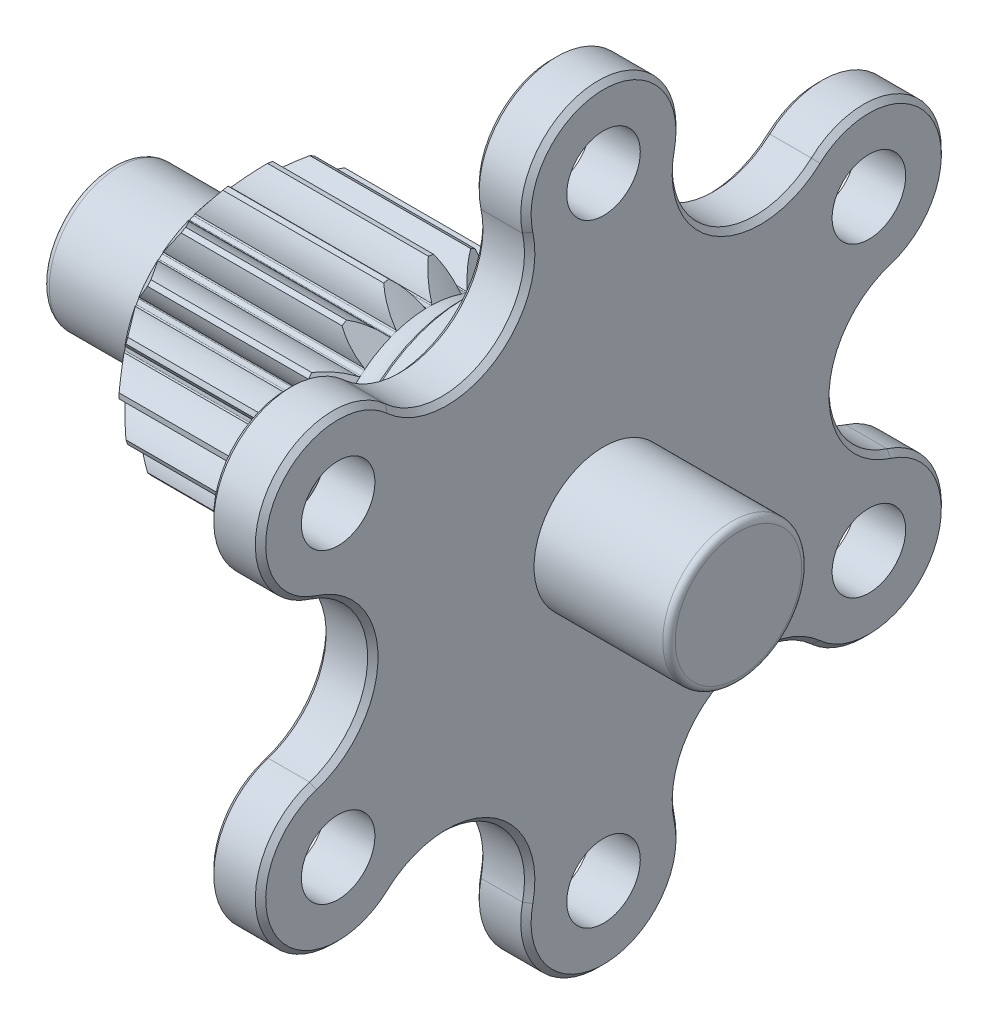
from build123d import *
from OCP.BRepFilletAPI import BRepFilletAPI_MakeChamfer

# Parameters (mm, degrees)
SKETCH1_R              = 47
BASE_EXTRUDE_DEPTH     = 6.35
M8_CLEARANCE_HOLES_D   = 9
CIRPATTERN_COUNT       = 6
CUT_EXTRUDE_DEPTH      = 67.770670957
CUT_EXTRUDE_DEPTH_BACK = 67.770670957
CHAMFER1_SIZE          = 0.635
SKETCH8_R              = 15.748
SHAFT_EXTRUDE_DEPTH    = 52.5820005
CHAMFER3_SIZE          = 0.635
SHAFT_CHAMFER_SIZE     = 1
CUT_EXTRUDE1_START     = -12.856999432
SKETCH45_R             = 15.748
SKETCH45_R_2           = 8.5127
CUT_EXTRUDE1_DEPTH     = 12.856999432
SKETCH55_R             = 8.5
BOSS_EXTRUDE4_DEPTH    = 16.51
SKETCH56_R             = 8.5127
BOSS_EXTRUDE5_DEPTH    = 1.143
FILLET9_R              = 1.524
CUT_EXTRUDE17_START    = -25.4
CUT_EXTRUDE17_DEPTH    = 25.4
CHAMFER6_SIZE          = 2.54
CHAMFER6_SIZE2         = 3.027054125
FILLET10_R             = 1.27
FILLET11_R             = 0.762
FILLET12_R             = 0.762
SKETCH95_R             = 6.614412416
SKETCH95_R_2           = 4.5
CUT_EXTRUDE18_DEPTH    = 0.254
CHAMFER7_SIZE          = 0.508


with BuildPart() as part:
    # Sketch1 → Base-Extrude (new body)
    with BuildSketch(Plane(origin=(0, 0, 0), x_dir=(0, 0, -1), z_dir=(1, 0, 0))):
        Circle(SKETCH1_R)
    extrude(amount=-BASE_EXTRUDE_DEPTH)

    # M8 Clearance Holes (through all)
    with Locations(Plane(origin=(0, 0, 0), x_dir=(0, 0, -1), z_dir=(1, 0, 0))):
        with Locations((0, -37.5)):
            m8_clearance_holes = Hole(M8_CLEARANCE_HOLES_D / 2)

    # CirPattern: M8 Clearance Holes ×6 about axis
    cirpattern_axis = Axis((0, 0, 0), (1, 0, 0))
    for i in range(1, CIRPATTERN_COUNT):
        add(m8_clearance_holes.rotate(cirpattern_axis, i * 360 / CIRPATTERN_COUNT), mode=Mode.SUBTRACT)

    # Sketch19 → Cut-Extrude (cut, two sides: drawn at the far end of the back side and taken through both)
    with BuildSketch(Plane(origin=(0, 0, 0), x_dir=(0, 0, -1), z_dir=(1, 0, 0)).offset(-CUT_EXTRUDE_DEPTH_BACK)):
        with BuildLine():
            ThreePointArc((9.274838239, 35.443941724), (14.114033661, 24.446223401), (26.057934823, 25.754216393))
            ThreePointArc((26.057934823, 25.754216393), (33.921184851, 28.139425108), (40.703194264, 23.499999504))
            ThreePointArc((40.703194264, 23.499999504), (23.500000227, 40.703193847), (-4.7e-08, 47))
            ThreePointArc((-4.7e-08, 47), (7.40886473, 43.446320157), (9.274838239, 35.443941724))
        make_face()
        with BuildLine():
            ThreePointArc((-26.057934823, 25.754216393), (-14.114033661, 24.446223401), (-9.274838239, 35.443941724))
            ThreePointArc((-9.274838239, 35.443941724), (-7.40886476, 43.44632012), (-4.7e-08, 47))
            ThreePointArc((-4.7e-08, 47), (-23.500000787, 40.703193523), (-40.703194863, 23.499998466))
            ThreePointArc((-40.703194863, 23.499998466), (-33.921185443, 28.139425017), (-26.057934823, 25.754216393))
        make_face()
        with BuildLine():
            ThreePointArc((40.703193464, -23.50000089), (47, -8e-07), (40.703194264, 23.499999504))
            ThreePointArc((40.703194264, 23.499999504), (41.33004921, 15.30689472), (35.332773062, 9.689725331))
            ThreePointArc((35.332773062, 9.689725331), (28.228067323, 0), (35.332773062, -9.689725331))
            ThreePointArc((35.332773062, -9.689725331), (41.330049499, -15.306895465), (40.703193464, -23.50000089))
        make_face()
        with BuildLine():
            ThreePointArc((-35.332773062, 9.689725331), (-41.330048992, 15.306894161), (-40.703194863, 23.499998466))
            ThreePointArc((-40.703194863, 23.499998466), (-47, -6.9e-08), (-40.703194794, -23.499998586))
            ThreePointArc((-40.703194794, -23.499998586), (-41.330049018, -15.306894226), (-35.332773062, -9.689725331))
            ThreePointArc((-35.332773062, -9.689725331), (-28.228067323, 0), (-35.332773062, 9.689725331))
        make_face()
        with BuildLine():
            ThreePointArc((-26.057934823, -25.754216393), (-33.921185375, -28.139425028), (-40.703194794, -23.499998586))
            ThreePointArc((-40.703194794, -23.499998586), (-23.500000688, -40.703193581), (4.4e-08, -47))
            ThreePointArc((4.4e-08, -47), (-7.408864732, -43.446320155), (-9.274838239, -35.443941724))
            ThreePointArc((-9.274838239, -35.443941724), (-14.114033661, -24.446223401), (-26.057934823, -25.754216393))
        make_face()
        with BuildLine():
            ThreePointArc((4.4e-08, -47), (23.499999574, -40.703194224), (40.703193464, -23.50000089))
            ThreePointArc((40.703193464, -23.50000089), (33.92118406, -28.13942523), (26.057934823, -25.754216393))
            ThreePointArc((26.057934823, -25.754216393), (14.114033661, -24.446223401), (9.274838239, -35.443941724))
            ThreePointArc((9.274838239, -35.443941724), (7.408864759, -43.446320121), (4.4e-08, -47))
        make_face()
    extrude(amount=CUT_EXTRUDE_DEPTH + CUT_EXTRUDE_DEPTH_BACK, mode=Mode.SUBTRACT)

    # Chamfer1
    chamfer1_edges = [part.edges().sort_by_distance(p)[0] for p in [
        (-6.35, -24.446223401, 14.114033661),
        (-6.35, 24.446223401, -14.114033661),
        (-6.35, 24.446223401, 14.114033661),
        (-6.35, 23.5, 40.703193978),
        (-6.35, 47, 0),
        (-6.35, -24.446223401, -14.114033661),
        (-6.35, -23.5, -40.703193978),
        (-6.35, -47, 0),
        (-6.35, 0, 28.228067323),
        (-6.35, -23.5, 40.703193978),
        (-6.35, 0, -28.228067323),
        (-6.35, 23.5, -40.703193978),
    ]]
    chamfer(chamfer1_edges, length=CHAMFER1_SIZE)

    # Sketch8 → Shaft-Extrude (add)
    with BuildSketch(Plane.ZY.offset(6.35)):
        with Locations(Location((0, 0, 0), (0, 0, 180))):
            Circle(SKETCH8_R)
    extrude(amount=SHAFT_EXTRUDE_DEPTH)

    # Chamfer3
    chamfer3_edges = [part.edges().sort_by_distance(p)[0] for p in [
        (0, 24.446223401, -14.114033661),
        (0, -24.446223401, 14.114033661),
        (0, -24.446223401, -14.114033661),
        (0, -47, 0),
        (0, -23.5, -40.703193978),
        (0, 24.446223401, 14.114033661),
        (0, 47, 0),
        (0, 23.5, 40.703193978),
        (0, 0, -28.228067323),
        (0, 23.5, -40.703193978),
        (0, 0, 28.228067323),
        (0, -23.5, 40.703193978),
    ]]
    chamfer(chamfer3_edges, length=CHAMFER3_SIZE)

    # Shaft Chamfer
    shaft_chamfer_edges = [part.edges().sort_by_distance(p)[0] for p in [
        (-58.9320005, 0, 15.748),
    ]]
    chamfer(shaft_chamfer_edges, length=SHAFT_CHAMFER_SIZE)

    # Sketch45 → Cut-Extrude1 (cut)
    with BuildSketch(Plane.ZY.offset(58.9320005).offset(CUT_EXTRUDE1_START)):
        with Locations(Location((0, 0, 0), (0, 0, 180))):
            Circle(SKETCH45_R)
        Circle(SKETCH45_R_2, mode=Mode.SUBTRACT)
    extrude(amount=CUT_EXTRUDE1_DEPTH, mode=Mode.SUBTRACT)

    # Sketch55 → Boss-Extrude4 (add)
    with BuildSketch(Plane(origin=(0, 0, 0), x_dir=(0, 0, -1), z_dir=(1, 0, 0))):
        Circle(SKETCH55_R)
    extrude(amount=BOSS_EXTRUDE4_DEPTH)

    # Sketch56 → Boss-Extrude5 (add)
    with BuildSketch(Plane.ZY.offset(58.9320005)):
        Circle(SKETCH56_R)
    extrude(amount=BOSS_EXTRUDE5_DEPTH)

    # Fillet9
    fillet9_edges = [part.edges().sort_by_distance(p)[0] for p in [
        (-46.075001068, 0, -8.5127),
    ]]
    fillet(fillet9_edges, radius=FILLET9_R)

    # Cut-Extrude17: read off the stored shape, not the designer's step
    # Cut-Extrude17 outline → Cut-Extrude17 (cut)
    with BuildSketch(Plane.ZY.offset(46.075001068).offset(CUT_EXTRUDE17_START)):
        with BuildLine():
            ThreePointArc((-14.684667578, 5.688588763), (-12.987779277, 6.048943991), (-11.254165829, 5.986733001))
            ThreePointArc((-11.254165829, 5.986733001), (-11.162537651, 6.019355375), (-11.090657474, 6.084877757))
            ThreePointArc((-11.090657474, 6.084877757), (-10.95542401, 6.325117018), (-10.814987438, 6.562352263))
            ThreePointArc((-10.814987438, 6.562352263), (-10.794183479, 6.657363514), (-10.811745764, 6.753027031))
            ThreePointArc((-10.811745764, 6.753027031), (-11.732428783, 8.223274824), (-12.268796147, 9.873000815))
            ThreePointArc((-12.268796147, 9.873000815), (-13.63816805, 7.874000015), (-14.684667578, 5.688588763))
        make_face()
        with BuildLine():
            ThreePointArc((-12.469388985, 2.647934833), (-13.837402385, 3.714623697), (-14.905662359, 5.081410594))
            ThreePointArc((-14.905662359, 5.081410594), (-15.508752491, 2.73461152), (-15.744685706, 0.323072774))
            ThreePointArc((-15.744685706, 0.323072774), (-14.273381038, 1.242065902), (-12.623039862, 1.776537414))
            ThreePointArc((-12.623039862, 1.776537414), (-12.548095048, 1.8385311), (-12.50295975, 1.924686467))
            ThreePointArc((-12.50295975, 1.924686467), (-12.458048528, 2.196690097), (-12.407220551, 2.467650443))
            ThreePointArc((-12.407220551, 2.467650443), (-12.420166986, 2.564047187), (-12.469388985, 2.647934833))
        make_face()
        with BuildLine():
            ThreePointArc((-8.152132052, 13.473761428), (-10.122619264, 12.063667902), (-11.853461818, 10.367976993))
            ThreePointArc((-11.853461818, 10.367976993), (-10.135659657, 10.126230162), (-8.527873304, 9.474840233))
            ThreePointArc((-8.527873304, 9.474840233), (-8.430613472, 9.474156555), (-8.340658225, 9.511142985))
            ThreePointArc((-8.340658225, 9.511142985), (-8.13141367, 9.690641477), (-7.918307228, 9.865537551))
            ThreePointArc((-7.918307228, 9.865537551), (-7.86626214, 9.947703548), (-7.850046439, 10.043604504))
            ThreePointArc((-7.850046439, 10.043604504), (-8.212351117, 11.740077645), (-8.152132052, 13.473761428))
        make_face()
        with BuildLine():
            ThreePointArc((-12.623039866, -1.776537385), (-14.273381041, -1.24206587), (-15.744685707, -0.323072738))
            ThreePointArc((-15.744685707, -0.323072738), (-15.508752498, -2.734611484), (-14.905662371, -5.08141056))
            ThreePointArc((-14.905662371, -5.08141056), (-13.837402393, -3.714623666), (-12.469388991, -2.647934805))
            ThreePointArc((-12.469388991, -2.647934805), (-12.420166992, -2.564047159), (-12.407220557, -2.467650415))
            ThreePointArc((-12.407220557, -2.467650415), (-12.458048533, -2.196690069), (-12.502959755, -1.924686439))
            ThreePointArc((-12.502959755, -1.924686439), (-12.548095052, -1.838531072), (-12.623039866, -1.776537385))
        make_face()
        with BuildLine():
            ThreePointArc((-3.052200518, 15.449387561), (-5.3861332, 14.798279398), (-7.592553624, 13.796834183))
            ThreePointArc((-7.592553624, 13.796834183), (-6.061029895, 12.982143528), (-4.7729934, 11.8201419))
            ThreePointArc((-4.7729934, 11.8201419), (-4.681832885, 11.786234631), (-4.5846525, 11.790224))
            ThreePointArc((-4.5846525, 11.790224), (-4.326634836, 11.887331556), (-4.066562304, 11.978793409))
            ThreePointArc((-4.066562304, 11.978793409), (-3.989553493, 12.038203723), (-3.941515659, 12.122775047))
            ThreePointArc((-3.941515659, 12.122775047), (-3.701742705, 13.840853836), (-3.052200518, 15.449387561))
        make_face()
        with BuildLine():
            ThreePointArc((-11.254165843, -5.986732975), (-12.987779291, -6.048943962), (-14.684667591, -5.68858873))
            ThreePointArc((-14.684667591, -5.68858873), (-13.638168068, -7.873999984), (-12.26879617, -9.873000787))
            ThreePointArc((-12.26879617, -9.873000787), (-11.732428801, -8.223274797), (-10.811745779, -6.753027006))
            ThreePointArc((-10.811745779, -6.753027006), (-10.794183495, -6.657363489), (-10.814987453, -6.562352239))
            ThreePointArc((-10.814987453, -6.562352239), (-10.955424024, -6.325116993), (-11.090657488, -6.084877731))
            ThreePointArc((-11.090657488, -6.084877731), (-11.162537665, -6.01935535), (-11.254165843, -5.986732975))
        make_face()
        with BuildLine():
            ThreePointArc((2.415871444, 15.561589545), (1.8e-08, 15.748), (-2.415871408, 15.561589551))
            ThreePointArc((-2.415871408, 15.561589551), (-1.255350476, 14.272218789), (-0.44242005, 12.739760007))
            ThreePointArc((-0.44242005, 12.739760007), (-0.368354156, 12.676718864), (-0.275670021, 12.647229995))
            ThreePointArc((-0.275670021, 12.647229995), (1.5e-08, 12.65023401), (0.27567005, 12.647229995))
            ThreePointArc((0.27567005, 12.647229995), (0.368354185, 12.676718863), (0.442420079, 12.739760006))
            ThreePointArc((0.442420079, 12.739760006), (1.255350509, 14.272218786), (2.415871444, 15.561589545))
        make_face()
        with BuildLine():
            ThreePointArc((-8.527873325, -9.474840214), (-10.135659679, -10.126230139), (-11.853461841, -10.367976966))
            ThreePointArc((-11.853461841, -10.367976966), (-10.122619291, -12.063667879), (-8.152132082, -13.473761409))
            ThreePointArc((-8.152132082, -13.473761409), (-8.212351144, -11.740077626), (-7.850046462, -10.043604486))
            ThreePointArc((-7.850046462, -10.043604486), (-7.866262163, -9.94770353), (-7.91830725, -9.865537533))
            ThreePointArc((-7.91830725, -9.865537533), (-8.131413692, -9.690641459), (-8.340658247, -9.511142966))
            ThreePointArc((-8.340658247, -9.511142966), (-8.430613493, -9.474156536), (-8.527873325, -9.474840214))
        make_face()
        with BuildLine():
            ThreePointArc((7.592553655, 13.796834166), (5.386133234, 14.798279386), (3.052200553, 15.449387554))
            ThreePointArc((3.052200553, 15.449387554), (3.701742737, 13.840853828), (3.941515687, 12.122775038))
            ThreePointArc((3.941515687, 12.122775038), (3.98955352, 12.038203713), (4.066562331, 11.9787934))
            ThreePointArc((4.066562331, 11.9787934), (4.326634863, 11.887331546), (4.584652527, 11.79022399))
            ThreePointArc((4.584652527, 11.79022399), (4.681832912, 11.78623462), (4.772993427, 11.820141889))
            ThreePointArc((4.772993427, 11.820141889), (6.061029924, 12.982143514), (7.592553655, 13.796834166))
        make_face()
        with BuildLine():
            ThreePointArc((-4.772993427, -11.820141889), (-6.061029924, -12.982143514), (-7.592553655, -13.796834166))
            ThreePointArc((-7.592553655, -13.796834166), (-5.386133234, -14.798279386), (-3.052200553, -15.449387554))
            ThreePointArc((-3.052200553, -15.449387554), (-3.701742737, -13.840853828), (-3.941515687, -12.122775038))
            ThreePointArc((-3.941515687, -12.122775038), (-3.98955352, -12.038203713), (-4.066562331, -11.9787934))
            ThreePointArc((-4.066562331, -11.9787934), (-4.326634863, -11.887331546), (-4.584652527, -11.79022399))
            ThreePointArc((-4.584652527, -11.79022399), (-4.681832912, -11.78623462), (-4.772993427, -11.820141889))
        make_face()
        with BuildLine():
            ThreePointArc((11.853461841, 10.367976966), (10.122619291, 12.063667879), (8.152132082, 13.473761409))
            ThreePointArc((8.152132082, 13.473761409), (8.212351144, 11.740077626), (7.850046462, 10.043604486))
            ThreePointArc((7.850046462, 10.043604486), (7.866262163, 9.94770353), (7.91830725, 9.865537533))
            ThreePointArc((7.91830725, 9.865537533), (8.131413692, 9.690641459), (8.340658247, 9.511142966))
            ThreePointArc((8.340658247, 9.511142966), (8.430613493, 9.474156536), (8.527873325, 9.474840214))
            ThreePointArc((8.527873325, 9.474840214), (10.135659679, 10.126230139), (11.853461841, 10.367976966))
        make_face()
        with BuildLine():
            ThreePointArc((-0.442420079, -12.739760006), (-1.255350509, -14.272218786), (-2.415871444, -15.561589545))
            ThreePointArc((-2.415871444, -15.561589545), (-1.8e-08, -15.748), (2.415871408, -15.561589551))
            ThreePointArc((2.415871408, -15.561589551), (1.255350476, -14.272218789), (0.44242005, -12.739760007))
            ThreePointArc((0.44242005, -12.739760007), (0.368354156, -12.676718864), (0.275670021, -12.647229995))
            ThreePointArc((0.275670021, -12.647229995), (-1.5e-08, -12.65023401), (-0.27567005, -12.647229995))
            ThreePointArc((-0.27567005, -12.647229995), (-0.368354185, -12.676718863), (-0.442420079, -12.739760006))
        make_face()
        with BuildLine():
            ThreePointArc((14.684667591, 5.68858873), (13.638168068, 7.873999984), (12.26879617, 9.873000787))
            ThreePointArc((12.26879617, 9.873000787), (11.732428801, 8.223274797), (10.811745779, 6.753027006))
            ThreePointArc((10.811745779, 6.753027006), (10.794183495, 6.657363489), (10.814987453, 6.562352239))
            ThreePointArc((10.814987453, 6.562352239), (10.955424024, 6.325116993), (11.090657488, 6.084877731))
            ThreePointArc((11.090657488, 6.084877731), (11.162537665, 6.01935535), (11.254165843, 5.986732975))
            ThreePointArc((11.254165843, 5.986732975), (12.987779291, 6.048943962), (14.684667591, 5.68858873))
        make_face()
        with BuildLine():
            ThreePointArc((3.941515659, -12.122775047), (3.701742705, -13.840853836), (3.052200518, -15.449387561))
            ThreePointArc((3.052200518, -15.449387561), (5.3861332, -14.798279398), (7.592553624, -13.796834183))
            ThreePointArc((7.592553624, -13.796834183), (6.061029895, -12.982143528), (4.7729934, -11.8201419))
            ThreePointArc((4.7729934, -11.8201419), (4.681832885, -11.786234631), (4.5846525, -11.790224))
            ThreePointArc((4.5846525, -11.790224), (4.326634836, -11.887331556), (4.066562304, -11.978793409))
            ThreePointArc((4.066562304, -11.978793409), (3.989553493, -12.038203723), (3.941515659, -12.122775047))
        make_face()
        with BuildLine():
            ThreePointArc((15.744685707, 0.323072738), (15.508752498, 2.734611484), (14.905662371, 5.08141056))
            ThreePointArc((14.905662371, 5.08141056), (13.837402393, 3.714623666), (12.469388991, 2.647934805))
            ThreePointArc((12.469388991, 2.647934805), (12.420166992, 2.564047159), (12.407220557, 2.467650415))
            ThreePointArc((12.407220557, 2.467650415), (12.458048533, 2.196690069), (12.502959755, 1.924686439))
            ThreePointArc((12.502959755, 1.924686439), (12.548095052, 1.838531072), (12.623039866, 1.776537385))
            ThreePointArc((12.623039866, 1.776537385), (14.273381041, 1.24206587), (15.744685707, 0.323072738))
        make_face()
        with BuildLine():
            ThreePointArc((7.850046439, -10.043604504), (8.212351117, -11.740077645), (8.152132052, -13.473761428))
            ThreePointArc((8.152132052, -13.473761428), (10.122619264, -12.063667902), (11.853461818, -10.367976993))
            ThreePointArc((11.853461818, -10.367976993), (10.135659657, -10.126230162), (8.527873304, -9.474840233))
            ThreePointArc((8.527873304, -9.474840233), (8.430613472, -9.474156555), (8.340658225, -9.511142985))
            ThreePointArc((8.340658225, -9.511142985), (8.13141367, -9.690641477), (7.918307228, -9.865537551))
            ThreePointArc((7.918307228, -9.865537551), (7.86626214, -9.947703548), (7.850046439, -10.043604504))
        make_face()
        with BuildLine():
            ThreePointArc((14.905662359, -5.081410594), (15.508752491, -2.73461152), (15.744685706, -0.323072774))
            ThreePointArc((15.744685706, -0.323072774), (14.273381038, -1.242065902), (12.623039862, -1.776537414))
            ThreePointArc((12.623039862, -1.776537414), (12.548095048, -1.8385311), (12.50295975, -1.924686467))
            ThreePointArc((12.50295975, -1.924686467), (12.458048528, -2.196690097), (12.407220551, -2.467650443))
            ThreePointArc((12.407220551, -2.467650443), (12.420166986, -2.564047187), (12.469388985, -2.647934833))
            ThreePointArc((12.469388985, -2.647934833), (13.837402385, -3.714623697), (14.905662359, -5.081410594))
        make_face()
        with BuildLine():
            ThreePointArc((10.811745764, -6.753027031), (11.732428783, -8.223274824), (12.268796147, -9.873000815))
            ThreePointArc((12.268796147, -9.873000815), (13.63816805, -7.874000015), (14.684667578, -5.688588763))
            ThreePointArc((14.684667578, -5.688588763), (12.987779277, -6.048943991), (11.254165829, -5.986733001))
            ThreePointArc((11.254165829, -5.986733001), (11.162537651, -6.019355375), (11.090657474, -6.084877757))
            ThreePointArc((11.090657474, -6.084877757), (10.95542401, -6.325117018), (10.814987438, -6.562352263))
            ThreePointArc((10.814987438, -6.562352263), (10.794183479, -6.657363514), (10.811745764, -6.753027031))
        make_face()
    extrude(amount=CUT_EXTRUDE17_DEPTH, mode=Mode.SUBTRACT)

    # Sketch94 → Cut-Revolve2 (revolve, cut)
    with BuildSketch(Plane.XY, mode=Mode.PRIVATE) as cut_revolve2_sk:
        with BuildLine():
            Line((-21.383096822, 12.652967625), (-23.850001068, 15.748))
            Line((-23.850001068, 15.748), (-17.500001068, 15.748))
            ThreePointArc((-17.500001068, 15.748), (-18.429937038, 13.50293597), (-20.675001068, 12.573))
            ThreePointArc((-20.675001068, 12.573), (-21.031299545, 12.593055247), (-21.383096822, 12.652967625))
        make_face()
    revolve(cut_revolve2_sk.sketch.rotate(Axis((-47.599001068, 0, 0), (-1, 0, 0)), 90), axis=Axis((-47.599001068, 0, 0), (-1, 0, 0)), mode=Mode.SUBTRACT)

    # Chamfer6: one chamfer whose edges measure the first distance from different faces: ONE call of the kernel's chamfer builder (chamfer() names one face for all edges)
    chamfer6_edges_1 = [part.edges().sort_by_distance(p)[0] for p in [
        (-46.075001068, 15.508752498, -2.734611484),
    ]]
    chamfer6_side_1 = [part.faces().sort_by_distance(p)[0] for p in [
        (-34.962501068, 15.508752498, -2.734611484),
    ]]
    chamfer6_edges_2 = [part.edges().sort_by_distance(p)[0] for p in [
        (-46.075001068, 13.638168068, -7.873999985),
    ]]
    chamfer6_side_2 = [part.faces().sort_by_distance(p)[0] for p in [
        (-34.962501068, 13.638168068, -7.873999985),
    ]]
    chamfer6_edges_3 = [part.edges().sort_by_distance(p)[0] for p in [
        (-46.075001068, 10.122619291, -12.063667879),
    ]]
    chamfer6_side_3 = [part.faces().sort_by_distance(p)[0] for p in [
        (-34.962501068, 10.122619291, -12.063667879),
    ]]
    chamfer6_edges_4 = [part.edges().sort_by_distance(p)[0] for p in [
        (-46.075001068, 5.386133234, -14.798279386),
    ]]
    chamfer6_side_4 = [part.faces().sort_by_distance(p)[0] for p in [
        (-34.962501068, 5.386133234, -14.798279386),
    ]]
    chamfer6_edges_5 = [part.edges().sort_by_distance(p)[0] for p in [
        (-46.075001068, 1.8e-08, -15.748),
    ]]
    chamfer6_side_5 = [part.faces().sort_by_distance(p)[0] for p in [
        (-34.962501068, 1.8e-08, -15.748),
    ]]
    chamfer6_edges_6 = [part.edges().sort_by_distance(p)[0] for p in [
        (-46.075001068, -5.3861332, -14.798279398),
    ]]
    chamfer6_side_6 = [part.faces().sort_by_distance(p)[0] for p in [
        (-34.962501068, -5.3861332, -14.798279398),
    ]]
    chamfer6_edges_7 = [part.edges().sort_by_distance(p)[0] for p in [
        (-46.075001068, -10.122619263, -12.063667902),
    ]]
    chamfer6_side_7 = [part.faces().sort_by_distance(p)[0] for p in [
        (-34.962501068, -10.122619263, -12.063667902),
    ]]
    chamfer6_edges_8 = [part.edges().sort_by_distance(p)[0] for p in [
        (-46.075001068, -13.63816805, -7.874000015),
    ]]
    chamfer6_side_8 = [part.faces().sort_by_distance(p)[0] for p in [
        (-34.962501068, -13.63816805, -7.874000015),
    ]]
    chamfer6_edges_9 = [part.edges().sort_by_distance(p)[0] for p in [
        (-46.075001068, -15.508752491, -2.73461152),
    ]]
    chamfer6_side_9 = [part.faces().sort_by_distance(p)[0] for p in [
        (-34.962501068, -15.508752491, -2.73461152),
    ]]
    chamfer6_edges_10 = [part.edges().sort_by_distance(p)[0] for p in [
        (-46.075001068, -15.508752498, 2.734611484),
    ]]
    chamfer6_side_10 = [part.faces().sort_by_distance(p)[0] for p in [
        (-34.962501068, -15.508752498, 2.734611484),
    ]]
    chamfer6_edges_11 = [part.edges().sort_by_distance(p)[0] for p in [
        (-46.075001068, -13.638168068, 7.873999985),
    ]]
    chamfer6_side_11 = [part.faces().sort_by_distance(p)[0] for p in [
        (-34.962501068, -13.638168068, 7.873999985),
    ]]
    chamfer6_edges_12 = [part.edges().sort_by_distance(p)[0] for p in [
        (-46.075001068, -10.122619291, 12.063667879),
    ]]
    chamfer6_side_12 = [part.faces().sort_by_distance(p)[0] for p in [
        (-34.962501068, -10.122619291, 12.063667879),
    ]]
    chamfer6_edges_13 = [part.edges().sort_by_distance(p)[0] for p in [
        (-46.075001068, -5.386133234, 14.798279386),
    ]]
    chamfer6_side_13 = [part.faces().sort_by_distance(p)[0] for p in [
        (-34.962501068, -5.386133234, 14.798279386),
    ]]
    chamfer6_edges_14 = [part.edges().sort_by_distance(p)[0] for p in [
        (-46.075001068, -1.8e-08, 15.748),
    ]]
    chamfer6_side_14 = [part.faces().sort_by_distance(p)[0] for p in [
        (-34.962501068, -1.8e-08, 15.748),
    ]]
    chamfer6_edges_15 = [part.edges().sort_by_distance(p)[0] for p in [
        (-46.075001068, 5.3861332, 14.798279398),
    ]]
    chamfer6_side_15 = [part.faces().sort_by_distance(p)[0] for p in [
        (-34.962501068, 5.3861332, 14.798279398),
    ]]
    chamfer6_edges_16 = [part.edges().sort_by_distance(p)[0] for p in [
        (-46.075001068, 10.122619263, 12.063667902),
    ]]
    chamfer6_side_16 = [part.faces().sort_by_distance(p)[0] for p in [
        (-34.962501068, 10.122619263, 12.063667902),
    ]]
    chamfer6_edges_17 = [part.edges().sort_by_distance(p)[0] for p in [
        (-46.075001068, 13.63816805, 7.874000015),
    ]]
    chamfer6_side_17 = [part.faces().sort_by_distance(p)[0] for p in [
        (-34.962501068, 13.63816805, 7.874000015),
    ]]
    chamfer6_edges_18 = [part.edges().sort_by_distance(p)[0] for p in [
        (-46.075001068, 15.508752491, 2.73461152),
    ]]
    chamfer6_side_18 = [part.faces().sort_by_distance(p)[0] for p in [
        (-34.962501068, 15.508752491, 2.73461152),
    ]]
    chamfer6 = BRepFilletAPI_MakeChamfer(part.part.solid().wrapped)
    for e in chamfer6_edges_1:
        chamfer6.Add(CHAMFER6_SIZE, CHAMFER6_SIZE2, e.wrapped, chamfer6_side_1[0].wrapped)  # the first distance lies on this face
    for e in chamfer6_edges_2:
        chamfer6.Add(CHAMFER6_SIZE, CHAMFER6_SIZE2, e.wrapped, chamfer6_side_2[0].wrapped)  # the first distance lies on this face
    for e in chamfer6_edges_3:
        chamfer6.Add(CHAMFER6_SIZE, CHAMFER6_SIZE2, e.wrapped, chamfer6_side_3[0].wrapped)  # the first distance lies on this face
    for e in chamfer6_edges_4:
        chamfer6.Add(CHAMFER6_SIZE, CHAMFER6_SIZE2, e.wrapped, chamfer6_side_4[0].wrapped)  # the first distance lies on this face
    for e in chamfer6_edges_5:
        chamfer6.Add(CHAMFER6_SIZE, CHAMFER6_SIZE2, e.wrapped, chamfer6_side_5[0].wrapped)  # the first distance lies on this face
    for e in chamfer6_edges_6:
        chamfer6.Add(CHAMFER6_SIZE, CHAMFER6_SIZE2, e.wrapped, chamfer6_side_6[0].wrapped)  # the first distance lies on this face
    for e in chamfer6_edges_7:
        chamfer6.Add(CHAMFER6_SIZE, CHAMFER6_SIZE2, e.wrapped, chamfer6_side_7[0].wrapped)  # the first distance lies on this face
    for e in chamfer6_edges_8:
        chamfer6.Add(CHAMFER6_SIZE, CHAMFER6_SIZE2, e.wrapped, chamfer6_side_8[0].wrapped)  # the first distance lies on this face
    for e in chamfer6_edges_9:
        chamfer6.Add(CHAMFER6_SIZE, CHAMFER6_SIZE2, e.wrapped, chamfer6_side_9[0].wrapped)  # the first distance lies on this face
    for e in chamfer6_edges_10:
        chamfer6.Add(CHAMFER6_SIZE, CHAMFER6_SIZE2, e.wrapped, chamfer6_side_10[0].wrapped)  # the first distance lies on this face
    for e in chamfer6_edges_11:
        chamfer6.Add(CHAMFER6_SIZE, CHAMFER6_SIZE2, e.wrapped, chamfer6_side_11[0].wrapped)  # the first distance lies on this face
    for e in chamfer6_edges_12:
        chamfer6.Add(CHAMFER6_SIZE, CHAMFER6_SIZE2, e.wrapped, chamfer6_side_12[0].wrapped)  # the first distance lies on this face
    for e in chamfer6_edges_13:
        chamfer6.Add(CHAMFER6_SIZE, CHAMFER6_SIZE2, e.wrapped, chamfer6_side_13[0].wrapped)  # the first distance lies on this face
    for e in chamfer6_edges_14:
        chamfer6.Add(CHAMFER6_SIZE, CHAMFER6_SIZE2, e.wrapped, chamfer6_side_14[0].wrapped)  # the first distance lies on this face
    for e in chamfer6_edges_15:
        chamfer6.Add(CHAMFER6_SIZE, CHAMFER6_SIZE2, e.wrapped, chamfer6_side_15[0].wrapped)  # the first distance lies on this face
    for e in chamfer6_edges_16:
        chamfer6.Add(CHAMFER6_SIZE, CHAMFER6_SIZE2, e.wrapped, chamfer6_side_16[0].wrapped)  # the first distance lies on this face
    for e in chamfer6_edges_17:
        chamfer6.Add(CHAMFER6_SIZE, CHAMFER6_SIZE2, e.wrapped, chamfer6_side_17[0].wrapped)  # the first distance lies on this face
    for e in chamfer6_edges_18:
        chamfer6.Add(CHAMFER6_SIZE, CHAMFER6_SIZE2, e.wrapped, chamfer6_side_18[0].wrapped)  # the first distance lies on this face
    add(Compound.cast(chamfer6.Shape()), mode=Mode.REPLACE)

    # Fillet10
    fillet10_edges = [part.edges().sort_by_distance(p)[0] for p in [
        (-6.35, 0, 15.748),
    ]]
    fillet(fillet10_edges, radius=FILLET10_R)

    # Fillet11
    fillet11_edges = [part.edges().sort_by_distance(p)[0] for p in [
        (-60.0750005, 0, -8.5127),
    ]]
    fillet(fillet11_edges, radius=FILLET11_R)

    # Fillet12
    fillet12_edges = [part.edges().sort_by_distance(p)[0] for p in [
        (16.51, 0, 8.5),
    ]]
    fillet(fillet12_edges, radius=FILLET12_R)

    # Sketch95 → Cut-Extrude18 (cut)
    # profile 1 of 6: a face of its own
    with BuildSketch(Plane.ZY.offset(6.35)):
        with Locations((-32.475952642, 18.75)):
            Circle(SKETCH95_R)
        with Locations(Location((-32.475952642, 18.75, 0), (0, 0, 180))):
            Circle(SKETCH95_R_2, mode=Mode.SUBTRACT)
    # profile 2 of 6: a face of its own
    with BuildSketch(Plane.ZY.offset(6.35)):
        with Locations((0, 37.5)):
            Circle(SKETCH95_R)
        with Locations(Location((0, 37.5, 0), (0, 0, 180))):
            Circle(SKETCH95_R_2, mode=Mode.SUBTRACT)
    # profile 3 of 6: a face of its own
    with BuildSketch(Plane.ZY.offset(6.35)):
        with Locations((32.475952642, 18.75)):
            Circle(SKETCH95_R)
        with Locations(Location((32.475952642, 18.75, 0), (0, 0, 180))):
            Circle(SKETCH95_R_2, mode=Mode.SUBTRACT)
    # profile 4 of 6: a face of its own
    with BuildSketch(Plane.ZY.offset(6.35)):
        with Locations((32.475952642, -18.75)):
            Circle(SKETCH95_R)
        with Locations(Location((32.475952642, -18.75, 0), (0, 0, 180))):
            Circle(SKETCH95_R_2, mode=Mode.SUBTRACT)
    # profile 5 of 6: a face of its own
    with BuildSketch(Plane.ZY.offset(6.35)):
        with Locations((0, -37.5)):
            Circle(SKETCH95_R)
        with Locations(Location((0, -37.5, 0), (0, 0, 180))):
            Circle(SKETCH95_R_2, mode=Mode.SUBTRACT)
    # profile 6 of 6: a face of its own
    with BuildSketch(Plane.ZY.offset(6.35)):
        with Locations((-32.475952642, -18.75)):
            Circle(SKETCH95_R)
        with Locations(Location((-32.475952642, -18.75, 0), (0, 0, 180))):
            Circle(SKETCH95_R_2, mode=Mode.SUBTRACT)
    extrude(amount=-CUT_EXTRUDE18_DEPTH, mode=Mode.SUBTRACT)

    # Chamfer7
    # the kernel refuses this chamfer: 0.508 mm, written as the material it takes off along each edge
    with BuildSketch(Plane(origin=(-17.500001068, 0, 0), x_dir=(0, 0, -1), z_dir=(0, 1, 0))) as chamfer7_piece_1:
        with BuildLine():
            Line((15.748, -CHAMFER7_SIZE), (15.190708024, 0.049291976))
            ThreePointArc((15.190708024, 0.049291976), (15.460461722, 0.013047006), (15.748, 0))
            Line((15.748, 0), (15.748, -CHAMFER7_SIZE))
        make_face()
    revolve(axis=Axis((-17.500001068, 0, 0), (-1, 0, 0)), mode=Mode.SUBTRACT)


solid = part.part
